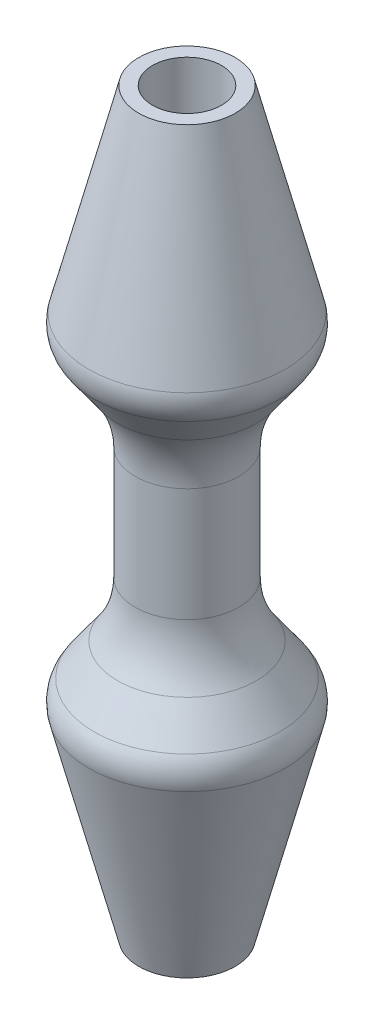
from build123d import *

# Parameters (mm, degrees)
CHAMFER1_SIZE       = 4.28
CHAMFER1_SIZE2      = 4.038825392
SKETCH8_R           = 4.5
BOSS_EXTRUDE2_DEPTH = 9.5
FILLET2_R           = 3
SKETCH9_R           = 3
CUT_EXTRUDE2_DEPTH  = 66.346851097


with BuildPart() as part:
    # Sketch7 → Revolve1 (revolve)
    with BuildSketch(Plane(origin=(0, 0, 0), x_dir=(0, 0, -1), z_dir=(1, 0, 0))):
        Polygon((0, 0), (0, 22.597995894), (4.193169033, 22.597995894), (9.941146123, 0), align=None)
    revolve(axis=Axis((0, 0, 0), (0, 1, 0)))

    # Chamfer1
    chamfer1_edges = [part.edges().sort_by_distance(p)[0] for p in [
        (0, 0, 9.941146123),
    ]]
    chamfer1_side = [part.faces().sort_by_distance(p)[0] for p in [
        (0, 11.298997947, 7.067157578),
    ]]
    chamfer(chamfer1_edges, length=CHAMFER1_SIZE, length2=CHAMFER1_SIZE2, reference=chamfer1_side[0])

    # Sketch8 → Boss-Extrude2 (add)
    with BuildSketch(Plane.XZ):
        with Locations(Location((0, 0, 0), (0, 0, 270))):
            Circle(SKETCH8_R)
    extrude(amount=BOSS_EXTRUDE2_DEPTH)

    # Fillet2
    fillet2_edges = [part.edges().sort_by_distance(p)[0] for p in [
        (0, 4.147921891, 8.886089732),
    ]]
    fillet(fillet2_edges, radius=FILLET2_R)

    # Fillet3: read off the stored shape, not the designer's step
    # Fillet3 outline → Fillet3 (revolve)
    with BuildSketch(Plane.XY):
        with BuildLine():
            Line((4.5, 0), (4.5, -4.576097384))
            ThreePointArc((4.5, -4.576097384), (4.892931369, -2.076097384), (6.033834832, 0.182825888))
            Line((6.033834832, 0.182825888), (5.902320731, 0.182825888))
            Line((5.902320731, 0.182825888), (5.902320731, 0))
            Line((5.902320731, 0), (4.5, 0))
        make_face()
    revolve(axis=Axis((0, 0, 0), (0, 1, 0)))

    # Mirror3: part across plane


with BuildPart() as part_1:
    add(part.part)
    add(part.part.mirror(Plane(origin=(0, -9.5, 0), x_dir=(0, 0, 1), z_dir=(0, -1, 0))))

    # Sketch9 → Cut-Extrude2 (cut, through all)
    with BuildSketch(Plane(origin=(0, 22.597995894, 0), x_dir=(1, 0, 0), z_dir=(0, 1, 0))):
        with Locations(Location((0, 0, 0), (0, 0, 270))):
            Circle(SKETCH9_R)
    extrude(amount=-CUT_EXTRUDE2_DEPTH, mode=Mode.SUBTRACT)


solid = part_1.part
